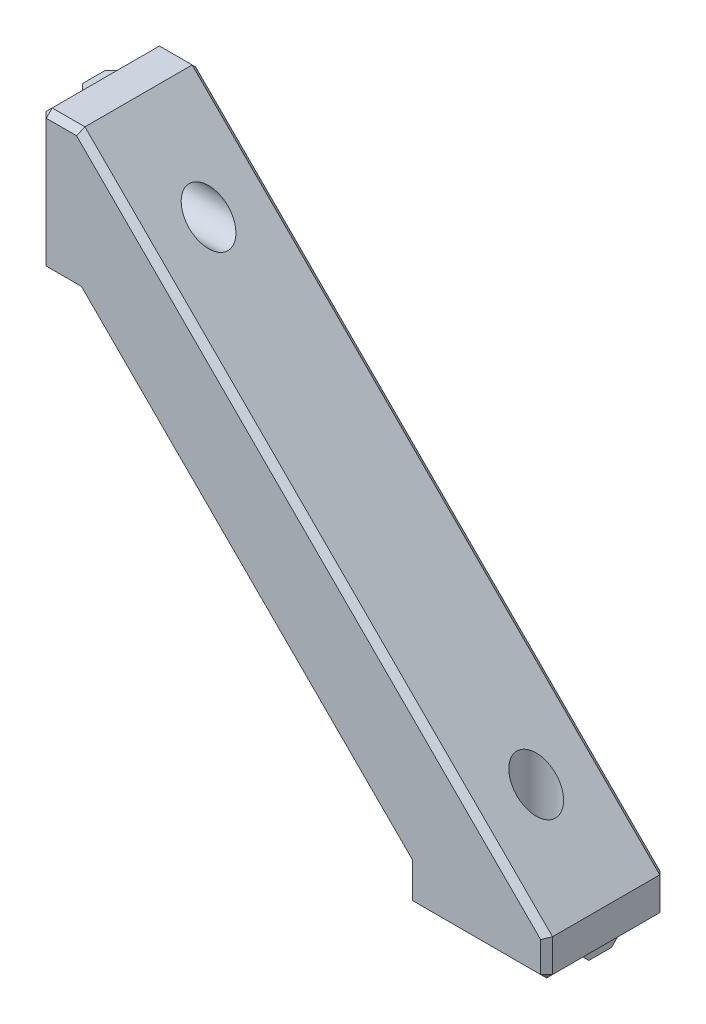
from build123d import *

# Parameters (mm, degrees)
BOSS_EXTRUDE1_DEPTH = 10
SKETCH29_W          = 20
SKETCH29_H          = 23.5
BOSS_EXTRUDE4_DEPTH = 6.5
SKETCH30_W          = 23.5
SKETCH30_H          = 20
BOSS_EXTRUDE5_DEPTH = 6.5
CHAMFER1_SIZE       = 1
SKETCH4_W           = 21.5
SKETCH4_H           = 5.8
BOSS_EXTRUDE2_DEPTH = 1
SKETCH5_W           = 5.8
SKETCH5_H           = 21.5
BOSS_EXTRUDE3_DEPTH = 1
CHAMFER2_SIZE       = 1


with BuildPart() as part:
    # Sketch2 → Boss-Extrude1 (new, symmetric)
    with BuildSketch(Plane.XY):
        Polygon((-8.159496186, 72.916243655), (70.340503814, -5.583756345), (46.840503814, -5.583756345), (-8.159496186, 49.416243655), align=None)
    extrude(amount=BOSS_EXTRUDE1_DEPTH, both=True)

    # Sketch29 → Boss-Extrude4 (add)
    with BuildSketch(Plane.ZY.offset(8.159496186)):
        with Locations((0, 61.166243655)):
            Rectangle(SKETCH29_W, SKETCH29_H)
    extrude(amount=BOSS_EXTRUDE4_DEPTH)

    # Sketch30 → Boss-Extrude5 (add)
    with BuildSketch(Plane.XZ.offset(5.583756345)):
        with Locations((58.590503814, 0)):
            Rectangle(SKETCH30_W, SKETCH30_H)
    extrude(amount=BOSS_EXTRUDE5_DEPTH)

    # Chamfer1
    chamfer1_edges = [part.edges().sort_by_distance(p)[0] for p in [
        (-11.409496186, 72.916243655, 10),
        (-11.409496186, 72.916243655, -10),
        (-11.409496186, 49.416243655, -10),
        (-11.409496186, 49.416243655, 10),
        (-14.659496186, 72.916243655, 0),
        (-14.659496186, 61.166243655, -10),
        (31.090503814, 33.666243655, 10),
        (-14.659496186, 49.416243655, 0),
        (-14.659496186, 61.166243655, 10),
        (46.840503814, -8.833756345, 10),
        (46.840503814, -8.833756345, -10),
        (70.340503814, -8.833756345, -10),
        (70.340503814, -8.833756345, 10),
        (46.840503814, -12.083756345, 0),
        (58.590503814, -12.083756345, -10),
        (70.340503814, -12.083756345, 0),
        (58.590503814, -12.083756345, 10),
        (31.090503814, 33.666243655, -10),
        (19.340503814, 21.916243655, -10),
        (19.340503814, 21.916243655, 10),
    ]]
    chamfer(chamfer1_edges, length=CHAMFER1_SIZE)

    # Sketch4 → Boss-Extrude2 (add)
    with BuildSketch(Plane.XZ.offset(12.083756345)):
        with Locations((58.590503814, 0)):
            Rectangle(SKETCH4_W, SKETCH4_H)
    extrude(amount=BOSS_EXTRUDE2_DEPTH)

    # Sketch5 → Boss-Extrude3 (add)
    with BuildSketch(Plane.ZY.offset(14.659496186)):
        with Locations((0, 61.166243655)):
            Rectangle(SKETCH5_W, SKETCH5_H)
    extrude(amount=BOSS_EXTRUDE3_DEPTH)

    # Chamfer2
    chamfer2_edges = [part.edges().sort_by_distance(p)[0] for p in [
        (-15.659496186, 61.166243655, 2.9),
        (-15.659496186, 61.166243655, -2.9),
        (58.590503814, -13.083756345, -2.9),
        (58.590503814, -13.083756345, 2.9),
    ]]
    chamfer(chamfer2_edges, length=CHAMFER2_SIZE - 0.0001)  # a hair under: the kernel refuses the full size

    # Sketch34 → CBORE for M3 Hex Socket Head Cap Screw4 (revolve, cut)
    with BuildSketch(Plane(origin=(25.340503814, 61.166243655, 0), x_dir=(0, 0, -1), z_dir=(0, 1, 0))):
        Polygon((0, 0), (0, 41), (1.7, 41), (1.7, 37.425), (1.725, 37.4), (3.25, 37.4), (3.25, 0.025), (3.275, 0), align=None)
    revolve(axis=Axis((31.690503814, 61.166243655, 0), (-1, 0, 0)), mode=Mode.SUBTRACT)

    # Sketch36 → CBORE for M3 Hex Socket Head Cap Screw5 (revolve, cut)
    with BuildSketch(Plane(origin=(58.590503814, 27.916243655, 0), x_dir=(0, 0, 1), z_dir=(1, 0, 0))):
        Polygon((0, 0), (0, 41), (1.7, 41), (1.7, 37.425), (1.725, 37.4), (3.25, 37.4), (3.25, 0.025), (3.275, 0), align=None)
    revolve(axis=Axis((58.590503814, 34.266243655, 0), (0, -1, 0)), mode=Mode.SUBTRACT)


solid = part.part
